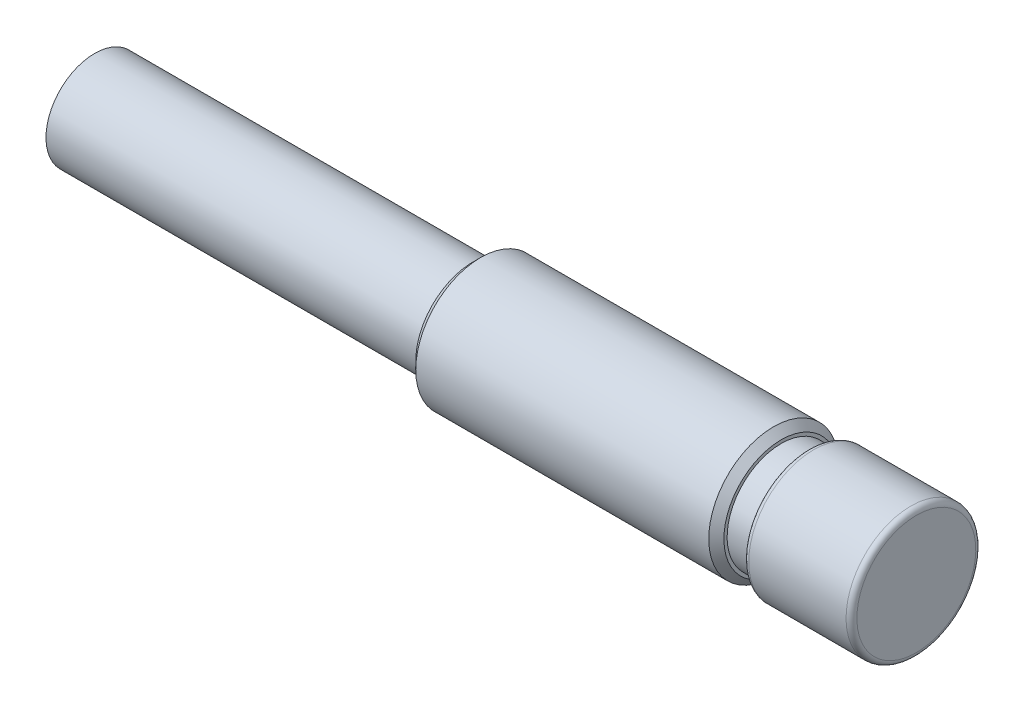
from build123d import *

# Parameters (mm, degrees)
CHANFRO1_SIZE         = 0.7
FILETE1_R             = 0.5
ESBO_O5_R             = 1.4
CORTE_EXTRUS_O1_DEPTH = 3
CHANFRO3_SIZE         = 2.8
FILETE2_R             = 4


with BuildPart() as part:
    # Esboço1 → Revolução1 (revolve)
    with BuildSketch(Plane.XY):
        Polygon((0, 0), (0, 4.5), (35, 4.5), (35, 6), (63.5, 6), (63.5, 5), (66, 5), (66, 6), (76, 6), (76, 0), align=None)
    revolve(axis=Axis((76, 0, 0), (-1, 0, 0)))

    # Chanfro1
    chanfro1_edges = [part.edges().sort_by_distance(p)[0] for p in [
        (63.5, -6, 0),
        (35, -6, 0),
    ]]
    chamfer(chanfro1_edges, length=CHANFRO1_SIZE)

    # Filete1
    filete1_edges = [part.edges().sort_by_distance(p)[0] for p in [
        (76, -6, 0),
        (66, -6, 0),
    ]]
    fillet(filete1_edges, radius=FILETE1_R)

    # Esboço5 → Corte-extrusão1 (cut)
    with BuildSketch(Plane.ZY):
        with Locations(Location((0, 0, 0), (0, 0, 270))):
            Circle(ESBO_O5_R)
    extrude(amount=-CORTE_EXTRUS_O1_DEPTH, mode=Mode.SUBTRACT)

    # Chanfro3
    chanfro3_edges = [part.edges().sort_by_distance(p)[0] for p in [
        (0, 1.4, 0),
    ]]
    chamfer(chanfro3_edges, length=CHANFRO3_SIZE)

    # Filete2
    # the kernel refuses this fillet: 4 mm, written as the material it adds along each edge
    with BuildSketch(Plane(origin=(3, 0, 0), x_dir=(0, -1, 0), z_dir=(0, 0, -1))) as filete2_piece_1:
        with BuildLine():
            CenterArc((0.1510004, 4), FILETE2_R, 270, 18.194872339)
            Line((0.1510004, 0), (0.1510004, -0.08))
            Line((0.1510004, -0.08), (1.4, -0.08))
            Line((1.4, -0.08), (1.48, 0))
            ThreePointArc((1.48, 0), (1.48, 0.1), (1.424979992, 0.124))
            Line((1.424979992, 0.124), (1.4, 0.2))
        make_face()
    revolve(axis=Axis((3, 0, 0), (-1, 0, 0)))


solid = part.part
